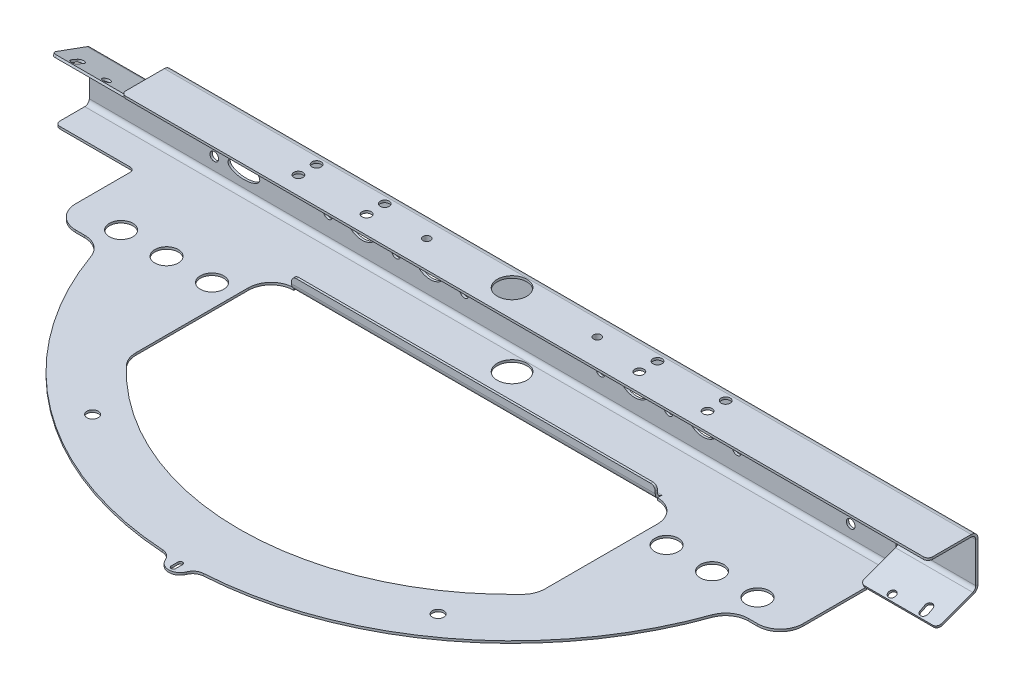
from build123d import *

# Parameters (mm, degrees)
ESQUISSE1_W                             = 300
ESQUISSE1_H                             = 31
T_LE_DE_BASE_PLI_E1_DEPTH               = 1
PATTE2_DEPTH                            = 1
T_LE_PLI_E_SUR_AR_TE1_STRIP_W           = 8
T_LE_PLI_E_SUR_AR_TE1_STRIP_H           = 1
T_LE_PLI_E_SUR_AR_TE1_STRIP_CUT_DEPTH   = 355
T_LE_PLI_E_SUR_AR_TE1_STRIP_2_W         = 8
T_LE_PLI_E_SUR_AR_TE1_STRIP_2_H         = 1
T_LE_PLI_E_SUR_AR_TE1_STRIP_CUT_2_DEPTH = 355
T_LE_PLI_E_SUR_AR_TE1_DEPTH             = 355
T_LE_PLI_E_SUR_AR_TE1_BEND_DEPTH        = 355
ESQUISSE9_R                             = 6.5
EXTRUSION1_DEPTH                        = 347.943799483
T_LE_START                              = -45
T_LE_PLI_E_SUR_AR_TE4_DEPTH             = 34
T_LE_START_2                            = 311
T_LE_PLI_E_SUR_AR_TE4_2_DEPTH           = 34
T_LE_PLI_E_SUR_AR_TE4_3_DEPTH           = 34
T_LE_PLI_E_SUR_AR_TE4_4_DEPTH           = 34
ESQUISSE48_R                            = 4.5
ENL_V_MAT_EXTRU_2_DEPTH                 = 10
ESQUISSE28_R                            = 2.75
EXTRUSION6_DEPTH                        = 7
TROU_TARAUD_M41_D                       = 3.3
TROU_TARAUD_M41_DEPTH                   = 11
TROU_TARAUD_M41_TIP                     = 0.991420021
ESQUISSE55_R                            = 1.9
ESQUISSE55_RX                           = 7
ESQUISSE55_RY                           = 3.25
EXTRUSION11_DEPTH                       = 10
EXTRUSION17_START                       = -1
ESQUISSE62_R                            = 2.5
EXTRUSION17_DEPTH                       = 1
ESQUISSE23_R                            = 1.6
ENL_V_MAT_EXTRU_1_DEPTH                 = 10
ESQUISSE27_R                            = 1.6
EXTRUSION3_DEPTH                        = 10
PATTE3_START                            = -1
PATTE3_DEPTH                            = 1
PATTE4_DEPTH                            = 1
ESQUISSE71_R                            = 5.15
EXTRUSION23_DEPTH                       = 10
CONG_1_R                                = 2
CONG_2_R                                = 10
T_LE_PLI_E_SUR_AR_TE5_STRIP_W           = 8
T_LE_PLI_E_SUR_AR_TE5_STRIP_H           = 1
T_LE_PLI_E_SUR_AR_TE5_STRIP_CUT_DEPTH   = 160
T_LE_PLI_E_SUR_AR_TE5_DEPTH             = 160
CONG_3_R                                = 2
PATTE5_DEPTH                            = 1
EXTRUSION24_DEPTH                       = 100
ESQUISSE78_R                            = 2
ESQUISSE78_R_2                          = 7.5
EXTRUSION25_DEPTH                       = 20
ESQUISSE80_R                            = 2
EXTRUSION26_DEPTH                       = 383.06020477


# Read off the part's stored shape, not the designer's step: Tôle pliée sur arête4, Patte3
# Sheet-metal steps are written as plain solids
with BuildPart() as part:
    # Esquisse1 → Tôle de base pliée1 (new body)
    with BuildSketch(Plane.XY):
        with Locations((150, 0)):
            Rectangle(ESQUISSE1_W, ESQUISSE1_H)
    extrude(amount=T_LE_DE_BASE_PLI_E1_DEPTH)

    # Esquisse19 → Patte2 (add)
    with BuildSketch(Plane.XY.offset(1)):
        Polygon((311, -6.5), (311, -2.5), (310, -2.5), (310, -15.5), (300, -15.5), (300, 15.5), (310, 15.5), (345, 15.5), (345, -6.5), align=None)
        Polygon((-10, 2.5), (-11, 2.5), (-11, 6.5), (-45, 6.5), (-45, -15.5), (-10, -15.5), (0, -15.5), (0, 15.5), (-10, 15.5), align=None)
    extrude(amount=-PATTE2_DEPTH)

    # Tôle pliée sur arête1 strip (across the edge) → Tôle pliée sur arête1 strip cut (cut)
    with BuildSketch(Plane(origin=(345, 15.5, 1), x_dir=(0, -1, 0), z_dir=(-1, 0, 0))):
        with Locations((-2, -0.5)):
            Rectangle(T_LE_PLI_E_SUR_AR_TE1_STRIP_W, T_LE_PLI_E_SUR_AR_TE1_STRIP_H)
    extrude(amount=T_LE_PLI_E_SUR_AR_TE1_STRIP_CUT_DEPTH, mode=Mode.SUBTRACT)

    # Tôle pliée sur arête1 strip 2 (across the edge) → Tôle pliée sur arête1 strip cut 2 (cut)
    with BuildSketch(Plane(origin=(-45, -15.5, 1), x_dir=(0, 1, 0), z_dir=(1, 0, 0))):
        with Locations((-2, -0.5)):
            Rectangle(T_LE_PLI_E_SUR_AR_TE1_STRIP_2_W, T_LE_PLI_E_SUR_AR_TE1_STRIP_2_H)
    extrude(amount=T_LE_PLI_E_SUR_AR_TE1_STRIP_CUT_2_DEPTH, mode=Mode.SUBTRACT)

    # Tôle pliée sur arête1 section (across the edge) → Tôle pliée sur arête1 (add)
    with BuildSketch(Plane(origin=(345, 15.5, 1), x_dir=(0, -1, 0), z_dir=(-1, 0, 0))):
        with BuildLine():
            Line((-1, 2), (-1, 15))
            Line((-1, 15), (0, 15))
            Line((0, 15), (0, 2))
            ThreePointArc((0, 2), (0.585786438, 0.585786438), (2, 0))
            Line((2, 0), (2, -1))
            ThreePointArc((2, -1), (-0.121320344, -0.121320344), (-1, 2))
        make_face()
    extrude(amount=T_LE_PLI_E_SUR_AR_TE1_DEPTH)

    # Tôle pliée sur arête1 section 2 (across the edge) → Tôle pliée sur arête1 bend (add)
    with BuildSketch(Plane(origin=(-45, -15.5, 1), x_dir=(0, 1, 0), z_dir=(1, 0, 0))):
        with BuildLine():
            Line((-1, 2), (-1, 15))
            Line((-1, 15), (0, 15))
            Line((0, 15), (0, 2))
            ThreePointArc((0, 2), (0.585786438, 0.585786438), (2, 0))
            Line((2, 0), (2, -1))
            ThreePointArc((2, -1), (-0.121320344, -0.121320344), (-1, 2))
        make_face()
    extrude(amount=T_LE_PLI_E_SUR_AR_TE1_BEND_DEPTH)

    # Esquisse9 → Extrusion1 (cut, through all)
    with BuildSketch(Plane.XZ.offset(16.5)):
        with Locations((150, 10)):
            Circle(ESQUISSE9_R)
    extrude(amount=-EXTRUSION1_DEPTH, mode=Mode.SUBTRACT)

    # Tôle pliée sur arête4 outline → Tôle pliée sur arête4 (cut)
    with BuildSketch(Plane.YZ.offset(T_LE_START)):
        with BuildLine():
            Line((6.5, 1), (6.271475128, 1))
            ThreePointArc((6.271475128, 1), (5.260152022, 0.261387212), (4.035407151, 0))
            Line((4.035407151, 0), (6.5, 0))
            Line((6.5, 0), (6.5, 1))
        make_face()
    extrude(amount=T_LE_PLI_E_SUR_AR_TE4_DEPTH, mode=Mode.SUBTRACT)

    # T_le pli_e sur ar_te4 2 outline → T_le pli_e sur ar_te4 2 (cut)
    with BuildSketch(Plane.YZ.offset(T_LE_START_2)):
        with BuildLine():
            Line((-6.5, 0), (-4.035407151, 0))
            ThreePointArc((-4.035407151, 0), (-5.260152022, 0.261387212), (-6.271475128, 1))
            Line((-6.271475128, 1), (-6.5, 1))
            Line((-6.5, 1), (-6.5, 0))
        make_face()
    extrude(amount=T_LE_PLI_E_SUR_AR_TE4_2_DEPTH, mode=Mode.SUBTRACT)

    # T_le pli_e sur ar_te4 3 outline → T_le pli_e sur ar_te4 3 (add)
    with BuildSketch(Plane.YZ.offset(T_LE_START)):
        with BuildLine():
            ThreePointArc((6.271475128, 1), (6.609463179, 1.459144535), (6.854485013, 1.97393957))
            Line((6.854485013, 1.97393957), (12.531877428, 17.572447031))
            Line((12.531877428, 17.572447031), (11.592184807, 17.914467174))
            Line((11.592184807, 17.914467174), (5.914792393, 2.315959713))
            ThreePointArc((5.914792393, 2.315959713), (5.182560024, 1.361695911), (4.035407151, 1))
            Line((4.035407151, 1), (6.271475128, 1))
        make_face()
    extrude(amount=T_LE_PLI_E_SUR_AR_TE4_3_DEPTH)

    # T_le pli_e sur ar_te4 4 outline → T_le pli_e sur ar_te4 4 (add)
    with BuildSketch(Plane.YZ.offset(T_LE_START_2)):
        with BuildLine():
            Line((-6.271475128, 1), (-4.035407151, 1))
            ThreePointArc((-4.035407151, 1), (-5.182560024, 1.361695911), (-5.914792393, 2.315959713))
            Line((-5.914792393, 2.315959713), (-11.592184807, 17.914467174))
            Line((-11.592184807, 17.914467174), (-12.531877428, 17.572447031))
            Line((-12.531877428, 17.572447031), (-6.854485013, 1.97393957))
            ThreePointArc((-6.854485013, 1.97393957), (-6.609463179, 1.459144535), (-6.271475128, 1))
        make_face()
    extrude(amount=T_LE_PLI_E_SUR_AR_TE4_4_DEPTH)

    # Esquisse48 → Enlèv. mat.-Extru.2 (cut)
    with BuildSketch(Plane(origin=(0, 0, 0), x_dir=(-1, 0, 0), z_dir=(0, 0, -1))):
        with Locations((-10, 0)):
            Circle(ESQUISSE48_R)
        with Locations((-290, 0)):
            Circle(ESQUISSE48_R)
    extrude(amount=-ENL_V_MAT_EXTRU_2_DEPTH, mode=Mode.SUBTRACT)

    # Esquisse28 → Extrusion6 (add)
    with BuildSketch(Plane(origin=(0, 16.5, 0), x_dir=(1, 0, 0), z_dir=(0, 1, 0))):
        with Locations(Location((187.5, -10, 0), (0, 0, 270))):
            Circle(ESQUISSE28_R)
        with Locations(Location((112.5, -10, 0), (0, 0, 270))):
            Circle(ESQUISSE28_R)
    extrude(amount=-EXTRUSION6_DEPTH)

    # Trou taraudé M41
    with Locations(Plane(origin=(112.5, 16.5, 10), x_dir=(0, 0, 1), z_dir=(0, 1, 0))):
        with Locations((0, 0), (0, 75)):
            Hole(TROU_TARAUD_M41_D / 2, depth=TROU_TARAUD_M41_DEPTH)
            with Locations((0, 0, -(TROU_TARAUD_M41_DEPTH + TROU_TARAUD_M41_TIP / 2))):  # 118° drill point
                Cone(0, TROU_TARAUD_M41_D / 2, TROU_TARAUD_M41_TIP, mode=Mode.SUBTRACT)

    # Esquisse55 → Extrusion11 (cut)
    with BuildSketch(Plane(origin=(0, 0, 0), x_dir=(-1, 0, 0), z_dir=(0, 0, -1))):
        with Locations((-10, 8)):
            Circle(ESQUISSE55_R)
        with Locations((-19.5, 0)):
            Circle(ESQUISSE55_R)
        with Locations((-10, -8)):
            Circle(ESQUISSE55_R)
        with Locations((-0.5, 0)):
            Circle(ESQUISSE55_R)
        with Locations((-280.5, 0)):
            Circle(ESQUISSE55_R)
        with Locations((-290, 8)):
            Circle(ESQUISSE55_R)
        with Locations((-299.5, 0)):
            Circle(ESQUISSE55_R)
        with Locations((-290, -8)):
            Circle(ESQUISSE55_R)
        with Locations(Location((-277, 7), (0, 0, -180))):
            Ellipse(ESQUISSE55_RX, ESQUISSE55_RY)
        with Locations((-23, -7)):
            Ellipse(ESQUISSE55_RX, ESQUISSE55_RY)
    extrude(amount=-EXTRUSION11_DEPTH, mode=Mode.SUBTRACT)

    # Esquisse62 → Extrusion17 (add)
    with BuildSketch(Plane(origin=(0, -15.5, 0), x_dir=(1, 0, 0), z_dir=(0, 1, 0)).offset(EXTRUSION17_START)):
        with BuildLine():
            Line((35, -16), (5.124191115, -16))
            ThreePointArc((5.124191115, -16), (150, -155), (294.875808885, -16))
            Line((294.875808885, -16), (265, -16))
            Line((265, -16), (152.5, -16))
            ThreePointArc((152.5, -16), (150, -16.5), (147.5, -16))
            Line((147.5, -16), (35, -16))
        make_face()
        with Locations(Location((225.998877817, -118.537645868, 0), (0, 0, 270))):
            Circle(ESQUISSE62_R, mode=Mode.SUBTRACT)
        with Locations(Location((74.001122183, -118.537645868, 0), (0, 0, 90))):
            Circle(ESQUISSE62_R, mode=Mode.SUBTRACT)
        with BuildLine():
            Line((60, -26), (240, -26))
            Line((240, -26), (240, -89.372539332))
            ThreePointArc((240, -89.372539332), (150, -130), (60, -89.372539332))
            Line((60, -89.372539332), (60, -26))
        make_face(mode=Mode.SUBTRACT)
    extrude(amount=EXTRUSION17_DEPTH)

    # Esquisse23 → Enlèv. mat.-Extru.1 (cut)
    with BuildSketch(Plane(origin=(0, 5.418250635, -1.972081953), x_dir=(1, 0, 0), z_dir=(0, 0.939692620785907, -0.34202014332567254))):
        with Locations(Location((-23, -18.498853318, 0), (0, 0, 270))):
            Circle(ESQUISSE23_R)
        with BuildLine():
            ThreePointArc((-38.6, -18.498853318), (-37, -20.098853318), (-35.4, -18.498853318))
            ThreePointArc((-35.4, -18.498853318), (-35.35047508, -17.391710461), (-35.202295918, -16.29341134))
            ThreePointArc((-35.202295918, -16.29341134), (-36.492212556, -14.434348385), (-38.35127551, -15.724265023))
            ThreePointArc((-38.35127551, -15.724265023), (-38.537694455, -17.105996175), (-38.6, -18.498853318))
        make_face()
    extrude(amount=-ENL_V_MAT_EXTRU_1_DEPTH, mode=Mode.SUBTRACT)

    # Esquisse27 → Extrusion3 (cut)
    with BuildSketch(Plane(origin=(0, -5.418250635, -1.972081953), x_dir=(1, 0, 0), z_dir=(0, -0.939692620785907, -0.34202014332567254))):
        with Locations(Location((323, 18.498853318, 0), (0, 0, 270))):
            Circle(ESQUISSE27_R)
        with BuildLine():
            ThreePointArc((338.6, 18.498853318), (337, 20.098853318), (335.4, 18.498853318))
            ThreePointArc((335.4, 18.498853318), (335.35047508, 17.391710461), (335.202295918, 16.29341134))
            ThreePointArc((335.202295918, 16.29341134), (336.492212556, 14.434348385), (338.35127551, 15.724265023))
            ThreePointArc((338.35127551, 15.724265023), (338.537694455, 17.105996175), (338.6, 18.498853318))
        make_face()
    extrude(amount=-EXTRUSION3_DEPTH, mode=Mode.SUBTRACT)

    # Patte3 outline → Patte3 (add)
    with BuildSketch(Plane(origin=(0, 16.5, 0), x_dir=(1, 0, 0), z_dir=(0, 1, 0)).offset(PATTE3_START)):
        with BuildLine():
            Line((-10, -22), (345, -22))
            Line((345, -22), (345, -16))
            Line((345, -16), (152.5, -16))
            ThreePointArc((152.5, -16), (150, -16.5), (147.5, -16))
            Line((147.5, -16), (-10, -16))
            Line((-10, -16), (-10, -22))
        make_face()
    extrude(amount=PATTE3_DEPTH)

    # Esquisse66 → Patte4 (add)
    with BuildSketch(Plane.XZ.offset(16.5)):
        with BuildLine():
            Line((-10, 52), (11.215995158, 52))
            ThreePointArc((11.215995158, 52), (7.032442558, 34.192509566), (5.124191115, 16))
            Line((5.124191115, 16), (-10, 16))
            Line((-10, 16), (-10, 52))
        make_face()
        with BuildLine():
            Line((294.875808885, 16), (310, 16))
            Line((310, 16), (310, 52))
            Line((310, 52), (288.784004842, 52))
            ThreePointArc((288.784004842, 52), (292.967557442, 34.192509566), (294.875808885, 16))
        make_face()
    extrude(amount=-PATTE4_DEPTH)

    # Esquisse71 → Extrusion23 (cut)
    with BuildSketch(Plane(origin=(0, -15.5, 0), x_dir=(1, 0, 0), z_dir=(0, 1, 0))):
        with Locations(Location((30, -42, 0), (0, 0, 270))):
            Circle(ESQUISSE71_R)
        with Locations(Location((50, -42, 0), (0, 0, 270))):
            Circle(ESQUISSE71_R)
        with Locations(Location((10, -42, 0), (0, 0, 270))):
            Circle(ESQUISSE71_R)
        with Locations(Location((290, -42, 0), (0, 0, 270))):
            Circle(ESQUISSE71_R)
        with Locations(Location((270, -42, 0), (0, 0, 270))):
            Circle(ESQUISSE71_R)
        with Locations(Location((250, -42, 0), (0, 0, 270))):
            Circle(ESQUISSE71_R)
    extrude(amount=-EXTRUSION23_DEPTH, mode=Mode.SUBTRACT)

    # Congé1
    cong_1_edges = [part.edges().sort_by_distance(p)[0] for p in [
        (-11, 12.062031118, 17.743457102),
        (-45, 12.062031118, 17.743457102),
        (311, -12.062031118, 17.743457102),
        (345, -12.062031118, 17.743457102),
        (-10, 16, 22),
        (345, 16, 22),
    ]]
    fillet(cong_1_edges, radius=CONG_1_R)

    # Congé2
    cong_2_edges = [part.edges().sort_by_distance(p)[0] for p in [
        (60, -16, 89.372539332),
        (60, -16, 26),
        (240, -16, 26),
        (240, -16, 89.372539332),
        (11.215995158, -16, 52),
        (-10, -16, 52),
        (288.784004842, -16, 52),
        (310, -16, 52),
    ]]
    fillet(cong_2_edges, radius=CONG_2_R)

    # Tôle pliée sur arête5 strip (across the edge) → Tôle pliée sur arête5 strip cut (cut)
    with BuildSketch(Plane(origin=(70, -15.5, 26), x_dir=(0, 0, -1), z_dir=(1, 0, 0))):
        with Locations((-2, -0.5)):
            Rectangle(T_LE_PLI_E_SUR_AR_TE5_STRIP_W, T_LE_PLI_E_SUR_AR_TE5_STRIP_H)
    extrude(amount=T_LE_PLI_E_SUR_AR_TE5_STRIP_CUT_DEPTH, mode=Mode.SUBTRACT)

    # Tôle pliée sur arête5 section (across the edge) → Tôle pliée sur arête5 (add)
    with BuildSketch(Plane(origin=(70, -15.5, 26), x_dir=(0, 0, -1), z_dir=(1, 0, 0))):
        with BuildLine():
            Line((-1, 2), (-1, 5))
            Line((-1, 5), (0, 5))
            Line((0, 5), (0, 2))
            ThreePointArc((0, 2), (0.585786438, 0.585786438), (2, 0))
            Line((2, 0), (2, -1))
            ThreePointArc((2, -1), (-0.121320344, -0.121320344), (-1, 2))
        make_face()
    extrude(amount=T_LE_PLI_E_SUR_AR_TE5_DEPTH)

    # Congé3
    cong_3_edges = [part.edges().sort_by_distance(p)[0] for p in [
        (-45, -16, 16),
        (-10, -16, 16),
        (70, -10.5, 26.5),
        (230, -10.5, 26.5),
    ]]
    fillet(cong_3_edges, radius=CONG_3_R)

    # Esquisse79 → Patte5 (add)
    with BuildSketch(Plane.XZ.offset(16.5)):
        with BuildLine():
            ThreePointArc((154.642698976, 157.856164384), (150, 161), (145.357301024, 157.856164384))
            ThreePointArc((145.357301024, 157.856164384), (143.64495645, 155.66102983), (141.024115313, 154.721917808))
            ThreePointArc((141.024115313, 154.721917808), (150, 155), (158.975884687, 154.721917808))
            ThreePointArc((158.975884687, 154.721917808), (156.35504355, 155.66102983), (154.642698976, 157.856164384))
        make_face()
    extrude(amount=-PATTE5_DEPTH)

    # Esquisse77 → Extrusion24 (cut)
    with BuildSketch(Plane(origin=(0, -15.5, 0), x_dir=(1, 0, 0), z_dir=(0, 1, 0))):
        with BuildLine():
            Line((151, -156), (151, -159))
            ThreePointArc((151, -159), (150, -160), (149, -159))
            Line((149, -159), (149, -156))
            ThreePointArc((149, -156), (150, -155), (151, -156))
        make_face()
    extrude(amount=-EXTRUSION24_DEPTH, mode=Mode.SUBTRACT)

    # Esquisse78 → Extrusion25 (cut)
    with BuildSketch(Plane(origin=(0, 0, 0), x_dir=(-1, 0, 0), z_dir=(0, 0, -1))):
        with Locations((-210, 5.143639692)):
            Circle(ESQUISSE78_R)
        with Locations((-209.982046075, -4.856344191)):
            Circle(ESQUISSE78_R)
        with Locations((-90.017953925, -4.856344191)):
            Circle(ESQUISSE78_R)
        with Locations((-90, 5.143639692)):
            Circle(ESQUISSE78_R)
        with Locations((-180, 5.143639692)):
            Circle(ESQUISSE78_R)
        with Locations((-179.982046075, -4.856344191)):
            Circle(ESQUISSE78_R)
        with Locations((-120.017953925, -4.856344191)):
            Circle(ESQUISSE78_R)
        with Locations((-120, 5.143639692)):
            Circle(ESQUISSE78_R)
        with Locations((-240, 5.143639692)):
            Circle(ESQUISSE78_R)
        with Locations((-239.982046075, -4.856344191)):
            Circle(ESQUISSE78_R)
        with Locations((-60.017953925, -4.856344191)):
            Circle(ESQUISSE78_R)
        with Locations((-60, 5.143639692)):
            Circle(ESQUISSE78_R)
        with Locations((-225, 0.116700702)):
            Circle(ESQUISSE78_R_2)
        with Locations((-195, 0.116700702)):
            Circle(ESQUISSE78_R_2)
        with Locations((-105, 0.116700702)):
            Circle(ESQUISSE78_R_2)
        with Locations((-75, 0.116700702)):
            Circle(ESQUISSE78_R_2)
    extrude(amount=-EXTRUSION25_DEPTH, mode=Mode.SUBTRACT)

    # Esquisse80 → Extrusion26 (cut, through all)
    with BuildSketch(Plane.XZ.offset(15.5)):
        with Locations(Location((240, 14, 0), (0, 0, 270))):
            Circle(ESQUISSE80_R)
        with Locations(Location((240, 6, 0), (0, 0, 90))):
            Circle(ESQUISSE80_R)
        with Locations(Location((210, 14, 0), (0, 0, 270))):
            Circle(ESQUISSE80_R)
        with Locations(Location((210, 6, 0), (0, 0, 90))):
            Circle(ESQUISSE80_R)
        with Locations(Location((90, 6, 0), (0, 0, 270))):
            Circle(ESQUISSE80_R)
        with Locations(Location((90, 14, 0), (0, 0, 90))):
            Circle(ESQUISSE80_R)
        with Locations(Location((60, 6, 0), (0, 0, 270))):
            Circle(ESQUISSE80_R)
        with Locations(Location((60, 14, 0), (0, 0, 90))):
            Circle(ESQUISSE80_R)
    extrude(amount=-EXTRUSION26_DEPTH, mode=Mode.SUBTRACT)


solid = part.part
